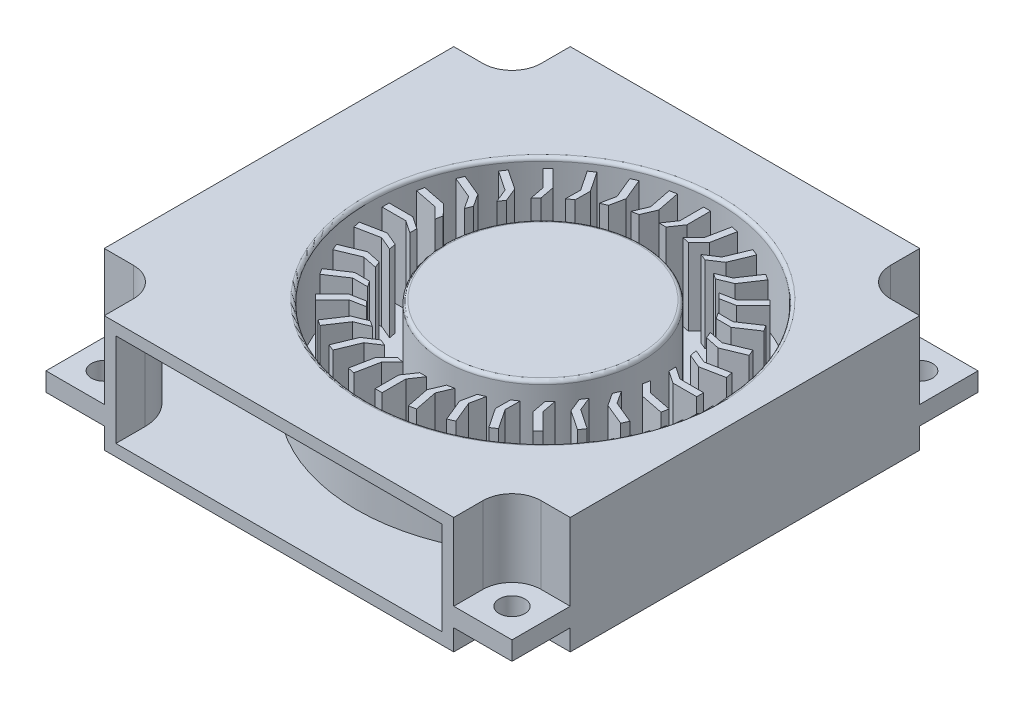
from build123d import *

# Parameters (mm, degrees)
SKETCH1_W           = 40
SKETCH1_H           = 40
SKETCH1_R           = 1.1
BOSS_EXTRUDE1_DEPTH = 10
SKETCH2_R           = 15
CUT_EXTRUDE1_DEPTH  = 6.6
CUT_EXTRUDE2_START  = -1.8
CUT_EXTRUDE2_DEPTH  = 1.8
SHELL1_START        = 1
SHELL1_OUTLINE_R    = 16
SHELL1_DEPTH        = 8
SHELL1_2_OUTLINE_R  = 16
SHELL1_2_DEPTH      = 1.4
SKETCH4_R           = 8.5
BOSS_EXTRUDE2_DEPTH = 6.6
FILLET1_R           = 0.3


# Read off the part's stored shape, not the designer's step: Shell1
with BuildPart() as part:
    # Sketch1 → Boss-Extrude1 (new body)
    with BuildSketch(Plane(origin=(0, 0, 0), x_dir=(1, 0, 0), z_dir=(0, 1, 0))):
        Rectangle(SKETCH1_W, SKETCH1_H)
        with Locations(Location((-17.5, 17.5, 0), (0, 0, 270))):
            Circle(SKETCH1_R, mode=Mode.SUBTRACT)
        with Locations(Location((17.5, 17.5, 0), (0, 0, 90))):
            Circle(SKETCH1_R, mode=Mode.SUBTRACT)
        with Locations(Location((-17.5, -17.5, 0), (0, 0, 90))):
            Circle(SKETCH1_R, mode=Mode.SUBTRACT)
        with Locations(Location((17.5, -17.5, 0), (0, 0, 270))):
            Circle(SKETCH1_R, mode=Mode.SUBTRACT)
    extrude(amount=BOSS_EXTRUDE1_DEPTH)

    # Sketch2 → Cut-Extrude1 (cut)
    with BuildSketch(Plane(origin=(0, 10, 0), x_dir=(1, 0, 0), z_dir=(0, 1, 0))):
        with Locations(Location((2.65, 0, 0), (0, 0, 270))):
            Circle(SKETCH2_R)
        with BuildLine():
            Line((-15, 17.5), (-15, 20))
            Line((-15, 20), (-20, 20))
            Line((-20, 20), (-20, 15))
            Line((-20, 15), (-17.5, 15))
            ThreePointArc((-17.5, 15), (-15.732233047, 15.732233047), (-15, 17.5))
        make_face()
        with BuildLine():
            Line((20, 20), (20, 15))
            Line((20, 15), (17.5, 15))
            ThreePointArc((17.5, 15), (15.732233047, 15.732233047), (15, 17.5))
            Line((15, 17.5), (15, 20))
            Line((15, 20), (20, 20))
        make_face()
        with BuildLine():
            Line((15, -17.5), (15, -20))
            Line((15, -20), (20, -20))
            Line((20, -20), (20, -15))
            Line((20, -15), (17.5, -15))
            ThreePointArc((17.5, -15), (15.732233047, -15.732233047), (15, -17.5))
        make_face()
        with BuildLine():
            Line((-20, -20), (-20, -15))
            Line((-20, -15), (-17.5, -15))
            ThreePointArc((-17.5, -15), (-15.732233047, -15.732233047), (-15, -17.5))
            Line((-15, -17.5), (-15, -20))
            Line((-15, -20), (-20, -20))
        make_face()
    extrude(amount=-CUT_EXTRUDE1_DEPTH, mode=Mode.SUBTRACT)

    # Sketch3 → Cut-Extrude2 (cut)
    with BuildSketch(Plane.XZ.offset(CUT_EXTRUDE2_START)):
        with BuildLine():
            Line((-17.5, -15), (-20, -15))
            Line((-20, -15), (-20, -20))
            Line((-20, -20), (-15, -20))
            Line((-15, -20), (-15, -17.5))
            ThreePointArc((-15, -17.5), (-15.732233047, -15.732233047), (-17.5, -15))
        make_face()
        with BuildLine():
            Line((15, -17.5), (15, -20))
            Line((15, -20), (20, -20))
            Line((20, -20), (20, -15))
            Line((20, -15), (17.5, -15))
            ThreePointArc((17.5, -15), (15.732233047, -15.732233047), (15, -17.5))
        make_face()
        with BuildLine():
            Line((17.5, 15), (20, 15))
            Line((20, 15), (20, 20))
            Line((20, 20), (15, 20))
            Line((15, 20), (15, 17.5))
            ThreePointArc((15, 17.5), (15.732233047, 15.732233047), (17.5, 15))
        make_face()
        with BuildLine():
            Line((-17.5, 15), (-20, 15))
            Line((-20, 15), (-20, 20))
            Line((-20, 20), (-15, 20))
            Line((-15, 20), (-15, 17.5))
            ThreePointArc((-15, 17.5), (-15.732233047, 15.732233047), (-17.5, 15))
        make_face()
    extrude(amount=CUT_EXTRUDE2_DEPTH, mode=Mode.SUBTRACT)

    # Shell1 outline → Shell1 (cut)
    with BuildSketch(Plane(origin=(0, 0, 0), x_dir=(1, 0, 0), z_dir=(0, 1, 0)).offset(SHELL1_START)):
        with BuildLine():
            Line((-19, 14), (-19, -14))
            Line((-19, -14), (-17.5, -14))
            ThreePointArc((-17.5, -14), (-15.025126266, -15.025126266), (-14, -17.5))
            Line((-14, -17.5), (-14, -20))
            Line((-14, -20), (14, -20))
            Line((14, -20), (14, -17.5))
            ThreePointArc((14, -17.5), (15.025126266, -15.025126266), (17.5, -14))
            Line((17.5, -14), (19, -14))
            Line((19, -14), (19, 14))
            Line((19, 14), (17.5, 14))
            ThreePointArc((17.5, 14), (15.025126266, 15.025126266), (14, 17.5))
            Line((14, 17.5), (14, 19))
            Line((14, 19), (-14, 19))
            Line((-14, 19), (-14, 17.5))
            ThreePointArc((-14, 17.5), (-15.025126266, 15.025126266), (-17.5, 14))
            Line((-17.5, 14), (-19, 14))
        make_face()
        with Locations((2.65, 0)):
            Circle(SHELL1_OUTLINE_R, mode=Mode.SUBTRACT)
    extrude(amount=SHELL1_DEPTH, mode=Mode.SUBTRACT)

    # Shell1 2 outline → Shell1 2 (cut)
    with BuildSketch(Plane(origin=(0, 0, 0), x_dir=(1, 0, 0), z_dir=(0, 1, 0)).offset(SHELL1_START)):
        with Locations((2.65, 0)):
            Circle(SHELL1_2_OUTLINE_R)
    extrude(amount=SHELL1_2_DEPTH, mode=Mode.SUBTRACT)

    # Sketch4 → Boss-Extrude2 (add)
    with BuildSketch(Plane(origin=(0, 3.4, 0), x_dir=(1, 0, 0), z_dir=(0, 1, 0))):
        with Locations(Location((2.65, 0, 0), (0, 0, 270))):
            Circle(SKETCH4_R)
        Polygon((2.65, 13.8), (2.65, 11.766296792), (1.924766683, 10.7), (2.524766683, 10.7), (3.25, 11.766296792), (3.25, 13.8), align=None)
        Polygon((5.342246444, 13.53483687), (4.94549063, 11.540210698), (4.026168283, 10.635888502), (4.614639452, 10.518834308), (5.533961798, 11.423156505), (5.930717612, 13.417782676), align=None)
        Polygon((7.931031367, 12.749537549), (7.152766842, 10.870640779), (6.074684508, 10.163045773), (6.629012228, 9.933435714), (7.707094562, 10.64103072), (8.485359086, 12.519927489), align=None)
        Polygon((10.316869216, 11.47428065), (9.18700425, 9.783318232), (7.991592028, 9.299642895), (8.490473796, 8.966300755), (9.685886018, 9.449976092), (10.815750983, 11.14093851), align=None)
        Polygon((12.40807358, 9.75807358), (10.970028251, 8.320028251), (9.703225162, 8.078859955), (10.127489231, 7.654595886), (11.39429232, 7.895764182), (12.832337649, 9.333809512), align=None)
        Polygon((14.12428065, 7.666869216), (12.433318232, 6.53700425), (11.143806809, 6.547610958), (11.477148948, 6.048729191), (12.766660371, 6.038122483), (14.45762279, 7.167987448), align=None)
        Polygon((15.399537549, 5.281031367), (13.520640779, 4.502766842), (12.257976223, 4.764740944), (12.487586282, 4.210413225), (13.750250839, 3.948439123), (15.629147608, 4.726703647), align=None)
        Polygon((16.18483687, 2.692246444), (14.190210698, 2.29549063), (13.002916499, 2.798764608), (13.119970692, 2.21029344), (14.307264891, 1.707019462), (16.301891063, 2.103775276), align=None)
        Polygon((16.45, 0), (14.416296792, 0), (13.35, 0.725233317), (13.35, 0.125233317), (14.416296792, -0.6), (16.45, -0.6), align=None)
        Polygon((16.18483687, -2.692246444), (14.190210698, -2.29549063), (13.285888502, -1.376168283), (13.168834308, -1.964639452), (14.073156505, -2.883961798), (16.067782676, -3.280717612), align=None)
        Polygon((15.399537549, -5.281031367), (13.520640779, -4.502766842), (12.813045773, -3.424684508), (12.583435714, -3.979012228), (13.29103072, -5.057094562), (15.169927489, -5.835359086), align=None)
        Polygon((14.12428065, -7.666869216), (12.433318232, -6.53700425), (11.949642895, -5.341592028), (11.616300755, -5.840473796), (12.099976092, -7.035886018), (13.79093851, -8.165750983), align=None)
        Polygon((12.40807358, -9.75807358), (10.970028251, -8.320028251), (10.728859955, -7.053225162), (10.304595886, -7.477489231), (10.545764182, -8.74429232), (11.983809512, -10.182337649), align=None)
        Polygon((10.316869216, -11.47428065), (9.18700425, -9.783318232), (9.197610958, -8.493806809), (8.698729191, -8.827148948), (8.688122483, -10.116660371), (9.817987448, -11.80762279), align=None)
        Polygon((7.931031367, -12.749537549), (7.152766842, -10.870640779), (7.414740944, -9.607976223), (6.860413225, -9.837586282), (6.598439123, -11.100250839), (7.376703647, -12.979147608), align=None)
        Polygon((5.342246444, -13.53483687), (4.94549063, -11.540210698), (5.448764608, -10.352916499), (4.86029344, -10.469970692), (4.357019462, -11.657264891), (4.753775276, -13.651891063), align=None)
        Polygon((2.65, -13.8), (2.65, -11.766296792), (3.375233317, -10.7), (2.775233317, -10.7), (2.05, -11.766296792), (2.05, -13.8), align=None)
        Polygon((-0.042246444, -13.53483687), (0.35450937, -11.540210698), (1.273831717, -10.635888502), (0.685360548, -10.518834308), (-0.233961798, -11.423156505), (-0.630717612, -13.417782676), align=None)
        Polygon((-2.631031367, -12.749537549), (-1.852766842, -10.870640779), (-0.774684508, -10.163045773), (-1.329012228, -9.933435714), (-2.407094562, -10.64103072), (-3.185359086, -12.519927489), align=None)
        Polygon((-5.016869216, -11.47428065), (-3.88700425, -9.783318232), (-2.691592028, -9.299642895), (-3.190473796, -8.966300755), (-4.385886018, -9.449976092), (-5.515750983, -11.14093851), align=None)
        Polygon((-7.10807358, -9.75807358), (-5.670028251, -8.320028251), (-4.403225162, -8.078859955), (-4.827489231, -7.654595886), (-6.09429232, -7.895764182), (-7.532337649, -9.333809512), align=None)
        Polygon((-8.82428065, -7.666869216), (-7.133318232, -6.53700425), (-5.843806809, -6.547610958), (-6.177148948, -6.048729191), (-7.466660371, -6.038122483), (-9.15762279, -7.167987448), align=None)
        Polygon((-10.099537549, -5.281031367), (-8.220640779, -4.502766842), (-6.957976223, -4.764740944), (-7.187586282, -4.210413225), (-8.450250839, -3.948439123), (-10.329147608, -4.726703647), align=None)
        Polygon((-10.88483687, -2.692246444), (-8.890210698, -2.29549063), (-7.702916499, -2.798764608), (-7.819970692, -2.21029344), (-9.007264891, -1.707019462), (-11.001891063, -2.103775276), align=None)
        Polygon((-11.15, 0), (-9.116296792, 0), (-8.05, -0.725233317), (-8.05, -0.125233317), (-9.116296792, 0.6), (-11.15, 0.6), align=None)
        Polygon((-10.88483687, 2.692246444), (-8.890210698, 2.29549063), (-7.985888502, 1.376168283), (-7.868834308, 1.964639452), (-8.773156505, 2.883961798), (-10.767782676, 3.280717612), align=None)
        Polygon((-10.099537549, 5.281031367), (-8.220640779, 4.502766842), (-7.513045773, 3.424684508), (-7.283435714, 3.979012228), (-7.99103072, 5.057094562), (-9.869927489, 5.835359086), align=None)
        Polygon((-8.82428065, 7.666869216), (-7.133318232, 6.53700425), (-6.649642895, 5.341592028), (-6.316300755, 5.840473796), (-6.799976092, 7.035886018), (-8.49093851, 8.165750983), align=None)
        Polygon((-7.10807358, 9.75807358), (-5.670028251, 8.320028251), (-5.428859955, 7.053225162), (-5.004595886, 7.477489231), (-5.245764182, 8.74429232), (-6.683809512, 10.182337649), align=None)
        Polygon((-5.016869216, 11.47428065), (-3.88700425, 9.783318232), (-3.897610958, 8.493806809), (-3.398729191, 8.827148948), (-3.388122483, 10.116660371), (-4.517987448, 11.80762279), align=None)
        Polygon((-2.631031367, 12.749537549), (-1.852766842, 10.870640779), (-2.114740944, 9.607976223), (-1.560413225, 9.837586282), (-1.298439123, 11.100250839), (-2.076703647, 12.979147608), align=None)
        Polygon((-0.042246444, 13.53483687), (0.35450937, 11.540210698), (-0.148764608, 10.352916499), (0.43970656, 10.469970692), (0.942980538, 11.657264891), (0.546224724, 13.651891063), align=None)
    extrude(amount=BOSS_EXTRUDE2_DEPTH)

    # Fillet1
    fillet1_edges = [part.edges().sort_by_distance(p)[0] for p in [
        (2.65, 10, -8.5),
        (2.65, 10, -15),
    ]]
    fillet(fillet1_edges, radius=FILLET1_R)


solid = part.part
